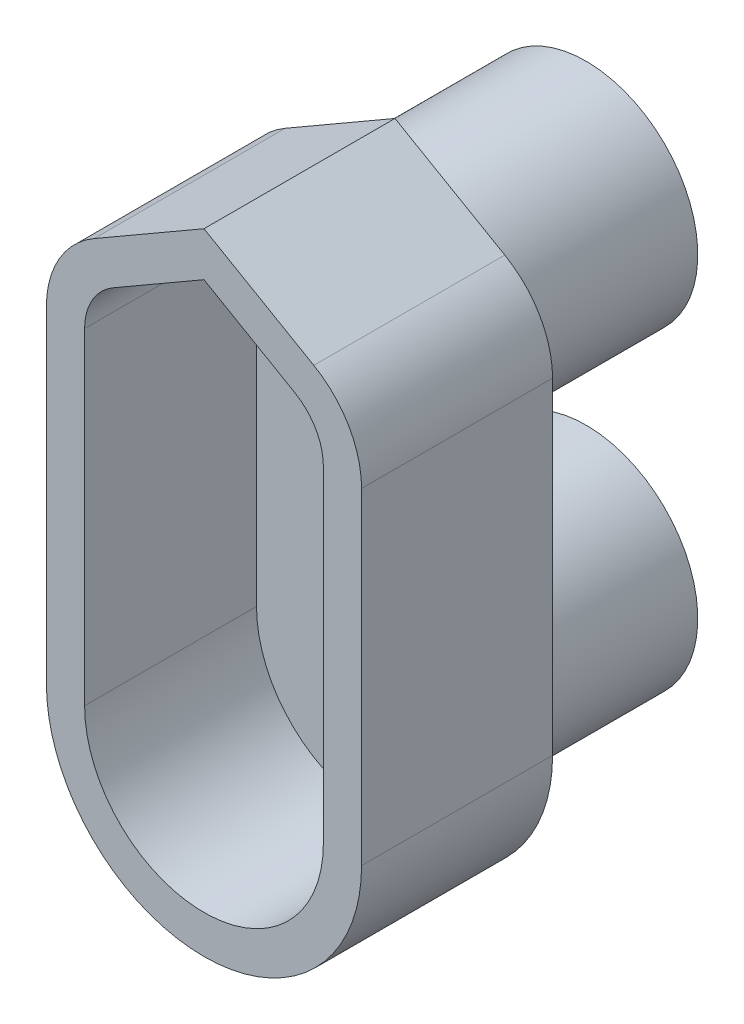
from build123d import *
from OCP.BRepFilletAPI import BRepFilletAPI_MakeChamfer

# Parameters (mm, degrees)
SKETCH1_W                       = 16.5
SKETCH1_H                       = 33
BOSS_EXTRUDE1_DEPTH             = 20
FILLET1_R                       = 8.25
CHAMFER1_SIZE                   = 8.25
CHAMFER1_SIZE_2                 = 4.763139721
SKETCH2_W                       = 16.5
SKETCH2_H                       = 33
SKETCH2_R                       = 5.85
SKETCH2_R_2                     = 5.05
CUT_EXTRUDE1_DEPTH              = 10
FILLET2_R                       = 5
SKETCH4_R                       = 5.1
BOSS_EXTRUDE2_DEPTH             = 7.3
SCHNITT_LINEAR_AUSTRAGEN1_DEPTH = 9


with BuildPart() as part:
    # Sketch1 → Boss-Extrude1 (new body)
    with BuildSketch(Plane.XY):
        with Locations((-18.614437814, 148.5)):
            Rectangle(SKETCH1_W, SKETCH1_H)
    extrude(amount=BOSS_EXTRUDE1_DEPTH)

    # Fillet1
    fillet1_edges = [part.edges().sort_by_distance(p)[0] for p in [
        (-26.864437814, 132, 10),
        (-10.364437814, 132, 10),
    ]]
    fillet(fillet1_edges, radius=FILLET1_R - 0.0001)  # a hair under: the kernel refuses the full size

    # Chamfer1
    chamfer1_edges_1 = [part.edges().sort_by_distance(p)[0] for p in [
        (-26.864437814, 165, 10),
    ]]
    chamfer1_side_1 = [part.faces().sort_by_distance(p)[0] for p in [
        (-26.769175019, 165, 10),
    ]]
    chamfer1_edges_2 = [part.edges().sort_by_distance(p)[0] for p in [
        (-10.364437814, 165, 10),
    ]]
    chamfer1_side_2 = [part.faces().sort_by_distance(p)[0] for p in [
        (-10.364437814, 164.904737206, 10),
    ]]
    chamfer1 = BRepFilletAPI_MakeChamfer(part.part.solid().wrapped)
    for e in chamfer1_edges_1:
        chamfer1.Add(CHAMFER1_SIZE - 0.0001, CHAMFER1_SIZE_2 - 0.0001, e.wrapped, chamfer1_side_1[0].wrapped)
    for e in chamfer1_edges_2:
        chamfer1.Add(CHAMFER1_SIZE_2 - 0.0001, CHAMFER1_SIZE - 0.0001, e.wrapped, chamfer1_side_2[0].wrapped)
    add(Compound.cast(chamfer1.Shape()), mode=Mode.REPLACE)  # a hair under: the kernel refuses the full size

    # Sketch2 → Cut-Extrude1 (cut)
    # profile 1 of 3: a face of its own
    with BuildSketch(Plane(origin=(0, 0, 0), x_dir=(-1, 0, 0), z_dir=(0, 0, -1))):
        with Locations((18.614437814, 148.5)):
            Rectangle(SKETCH2_W, SKETCH2_H)
        with Locations((18.614437814, 156.75)):
            Circle(SKETCH2_R, mode=Mode.SUBTRACT)
        with Locations((18.614437814, 140.25)):
            Circle(SKETCH2_R, mode=Mode.SUBTRACT)
    # profile 2 of 3: a face of its own
    with BuildSketch(Plane(origin=(0, 0, 0), x_dir=(-1, 0, 0), z_dir=(0, 0, -1))):
        with Locations((18.614437814, 140.25)):
            Circle(SKETCH2_R_2)
    # profile 3 of 3: a face of its own
    with BuildSketch(Plane(origin=(0, 0, 0), x_dir=(-1, 0, 0), z_dir=(0, 0, -1))):
        with Locations((18.614437814, 156.75)):
            Circle(SKETCH2_R_2)
    extrude(amount=-CUT_EXTRUDE1_DEPTH, mode=Mode.SUBTRACT)

    # Fillet2
    fillet2_edges = [part.edges().sort_by_distance(p)[0] for p in [
        (-26.864437814, 160.236960279, 15),
        (-10.364437814, 160.236960279, 15),
    ]]
    fillet(fillet2_edges, radius=FILLET2_R)

    # Sketch4 → Boss-Extrude2 (add)
    with BuildSketch(Plane(origin=(0, 0, 10), x_dir=(-1, 0, 0), z_dir=(0, 0, -1))):
        with Locations((18.614437814, 156.75)):
            Circle(SKETCH4_R)
        with Locations((18.614437814, 140.25)):
            Circle(SKETCH4_R)
    extrude(amount=BOSS_EXTRUDE2_DEPTH)

    # Skizze1 → Schnitt-Linear austragen1 (cut)
    with BuildSketch(Plane.XY.offset(20)):
        with BuildLine():
            Line((-12.364437814, 140.25), (-12.364437814, 157.350108933))
            ThreePointArc((-12.364437814, 157.350108933), (-12.766361602, 158.850108933), (-13.864437814, 159.948185145))
            Line((-13.864437814, 159.948185145), (-18.614437814, 162.690598923))
            Line((-18.614437814, 162.690598923), (-23.364437814, 159.948185145))
            ThreePointArc((-23.364437814, 159.948185145), (-24.462514025, 158.850108933), (-24.864437814, 157.350108933))
            Line((-24.864437814, 157.350108933), (-24.864437814, 140.25))
            ThreePointArc((-24.864437814, 140.25), (-23.033855196, 135.830582618), (-18.614437814, 134))
            ThreePointArc((-18.614437814, 134), (-14.195020431, 135.830582618), (-12.364437814, 140.25))
        make_face()
    extrude(amount=-SCHNITT_LINEAR_AUSTRAGEN1_DEPTH, mode=Mode.SUBTRACT)


solid = part.part
